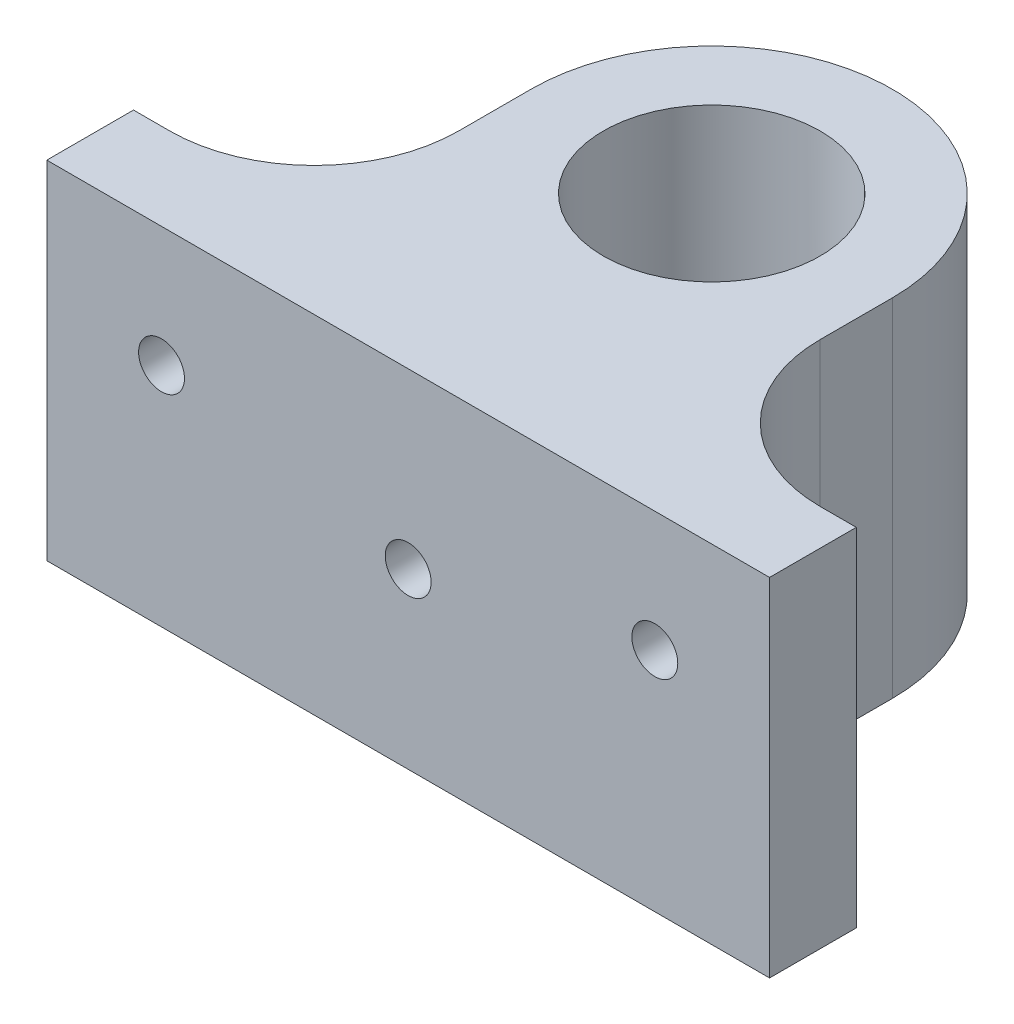
from build123d import *

# Parameters (mm, degrees)
PROFILE_SKETCH1_R                    = 7.5
PROFILE_BOSS_EXTRUDE2_DEPTH          = 24
FASTENINGHOLESKETCH3_R               = 1.5875
FASTENINGHOLECUT_EXTRUDE8_DEPTH      = 49.200103734
LM8UUFASTENINGHOLESKETCH5_R          = 1.5875
LM8UUFASTENINGHOLECUT_EXTRUDE9_DEPTH = 49.200103784


with BuildPart() as part:
    # Profile-Sketch1 → Profile-Boss-Extrude2 (new body)
    with BuildSketch(Plane(origin=(0, 0, 0), x_dir=(1, 0, 0), z_dir=(0, 1, 0))):
        with BuildLine():
            Line((-25, -21), (25, -21))
            Line((25, -21), (25, -15))
            Line((25, -15), (22.5, -15))
            ThreePointArc((22.5, -15), (15.428932188, -12.071067812), (12.5, -5))
            Line((12.5, -5), (12.5, 0))
            ThreePointArc((12.5, 0), (0, 12.5), (-12.5, 0))
            Line((-12.5, 0), (-12.5, -5))
            ThreePointArc((-12.5, -5), (-15.428932188, -12.071067812), (-22.5, -15))
            Line((-22.5, -15), (-25, -15))
            Line((-25, -15), (-25, -21))
        make_face()
        Circle(PROFILE_SKETCH1_R, mode=Mode.SUBTRACT)
    extrude(amount=PROFILE_BOSS_EXTRUDE2_DEPTH)

    # FasteningHoleSketch3 → FasteningHoleCut-Extrude8 (cut, through all)
    with BuildSketch(Plane.XY.offset(21)):
        with Locations((-17.0625, 15.677644)):
            Circle(FASTENINGHOLESKETCH3_R)
        with Locations((17.0625, 15.677644)):
            Circle(FASTENINGHOLESKETCH3_R)
    extrude(amount=-FASTENINGHOLECUT_EXTRUDE8_DEPTH, mode=Mode.SUBTRACT)

    # LM8UUFasteningHoleSketch5 → LM8UUFasteningHoleCut-Extrude9 (cut, through all)
    with BuildSketch(Plane.XY.offset(21)):
        with Locations((0, 12)):
            Circle(LM8UUFASTENINGHOLESKETCH5_R)
    extrude(amount=-LM8UUFASTENINGHOLECUT_EXTRUDE9_DEPTH, mode=Mode.SUBTRACT)


solid = part.part
